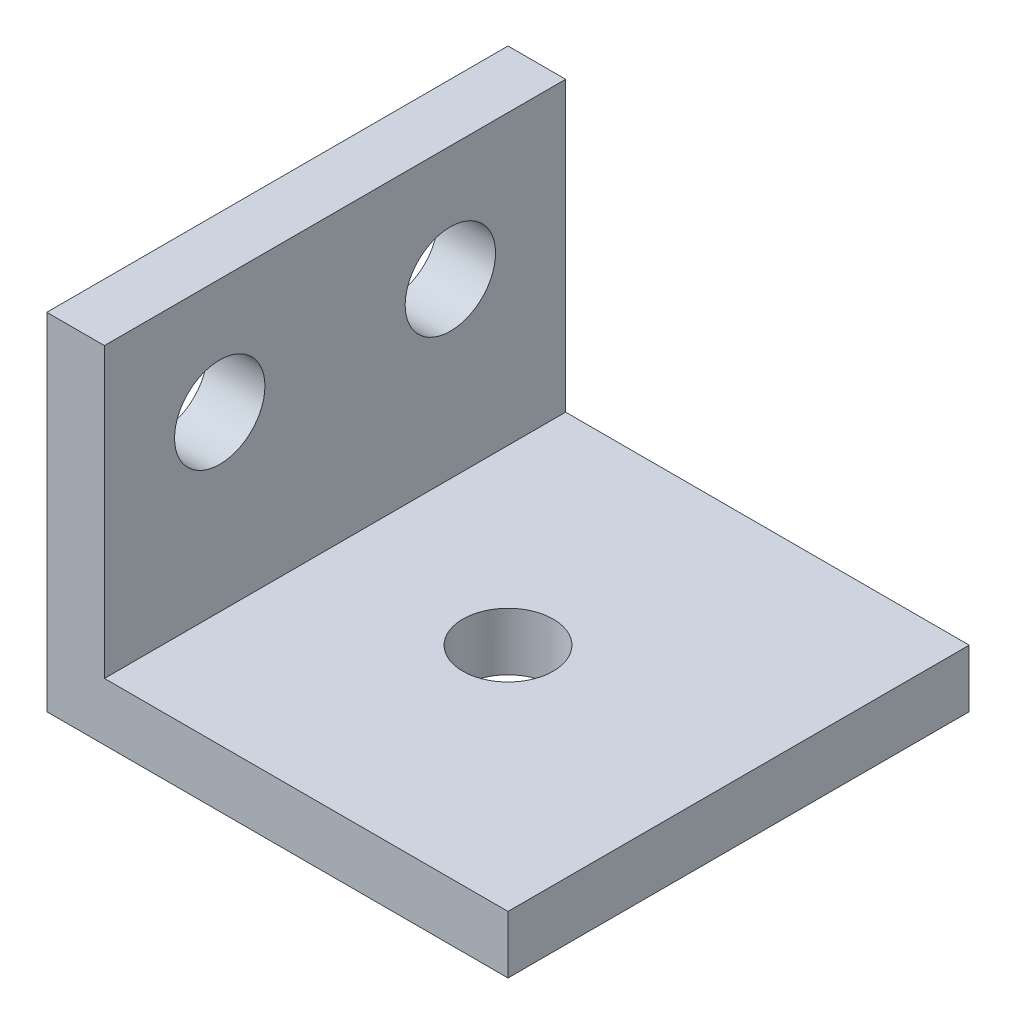
from build123d import *

# Parameters (mm, degrees)
BOSS_EXTRUDE1_DEPTH     = 12.7
CUT_EXTRUDE1_DEPTH      = 33.534068682
CUT_EXTRUDE1_DEPTH_BACK = 33.534068682
SKETCH3_R               = 2.4892
CUT_EXTRUDE2_DEPTH      = 32.908355097
CUT_EXTRUDE2_DEPTH_BACK = 32.908355097
SKETCH4_R               = 2.4892


with BuildPart() as part:
    # Sketch1 → Boss-Extrude1 (new, symmetric)
    with BuildSketch(Plane.XY):
        Polygon((0, 0), (0, 19.05), (3.175, 19.05), (3.175, 3.175), (25.4, 3.175), (25.4, 0), align=None)
    extrude(amount=BOSS_EXTRUDE1_DEPTH, both=True)

    # Sketch3 → Cut-Extrude1 (cut, two sides: drawn at the far end of the back side and taken through both)
    with BuildSketch(Plane(origin=(0, 3.175, 0), x_dir=(1, 0, 0), z_dir=(0, 1, 0)).offset(-CUT_EXTRUDE1_DEPTH_BACK)):
        with Locations((12.7, 0)):
            Circle(SKETCH3_R)
    extrude(amount=CUT_EXTRUDE1_DEPTH + CUT_EXTRUDE1_DEPTH_BACK, mode=Mode.SUBTRACT)

    # Sketch4 → Cut-Extrude2 (cut, two sides: drawn at the far end of the back side and taken through both)
    with BuildSketch(Plane(origin=(3.175, 0, 0), x_dir=(0, 0, -1), z_dir=(1, 0, 0)).offset(-CUT_EXTRUDE2_DEPTH_BACK)):
        with Locations((-6.35, 12.7)):
            Circle(SKETCH4_R)
        with Locations((6.35, 12.7)):
            Circle(SKETCH4_R)
    extrude(amount=CUT_EXTRUDE2_DEPTH + CUT_EXTRUDE2_DEPTH_BACK, mode=Mode.SUBTRACT)


solid = part.part
